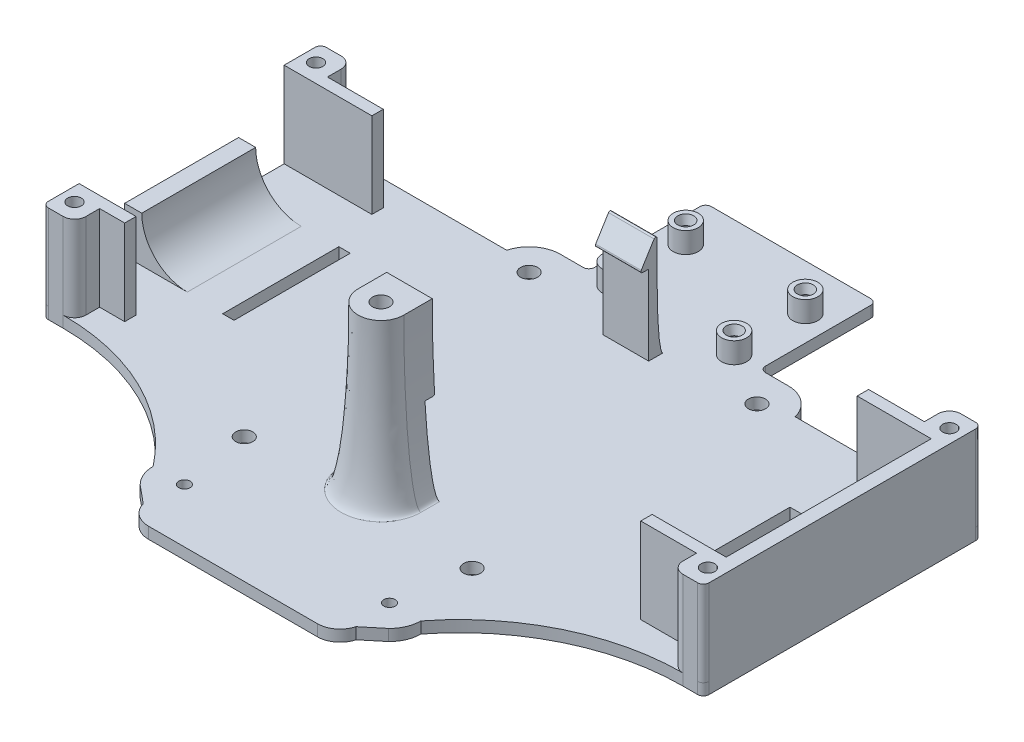
from build123d import *
from OCP.BRepFilletAPI import BRepFilletAPI_MakeChamfer, BRepFilletAPI_MakeFillet

# Parameters (mm, degrees)
SKETCH1_W            = 116
SKETCH1_H            = 98
SKETCH1_R            = 1.5
BOSS_EXTRUDE1_DEPTH  = 2
FILLET1_R            = 5
SKETCH4_R            = 1.2
BOSS_EXTRUDE3_DEPTH  = 15
FILLET2_R1           = 2
FILLET2_R2           = 1
CUT_EXTRUDE1_DEPTH   = 15
SKETCH7_R            = 2.2
BOSS_EXTRUDE4_DEPTH  = 3.65
SKETCH8_R            = 1
CUT_EXTRUDE2_DEPTH   = 153.278765755
CHAMFER2_SIZE        = 0.4
CHAMFER2_SIZE2       = 1.492820323
SKETCH9_R            = 1
CUT_EXTRUDE3_DEPTH   = 3.65
SKETCH10_W           = 3
SKETCH10_H           = 20
BOSS_EXTRUDE5_DEPTH  = 8
CUT_EXTRUDE4_DEPTH   = 4
FILLET4_R            = 1
SKETCH12_W           = 116
SKETCH12_H           = 48.8
CUT_EXTRUDE5_DEPTH   = 15
SKETCH13_R           = 1.2
BOSS_EXTRUDE6_DEPTH  = 15
SKETCH14_R           = 1.2
BOSS_EXTRUDE7_DEPTH  = 15
SKETCH15_W           = 3
SKETCH15_H           = 20
BOSS_EXTRUDE8_DEPTH  = 8
FILLET5_R            = 8
FILLET6_R1           = 2
FILLET6_R2           = 1
SKETCH17_R           = 1.5
BOSS_EXTRUDE9_DEPTH  = 28.5
FILLET8_SIZE         = 3
FILLET8_SIZE_2       = 28.5
SKETCH18_W           = 14
SKETCH18_H           = 1.6
CUT_EXTRUDE6_DEPTH   = 14
MOVE_FACE1_BY        = 0.1
SKETCH19_W           = 8
SKETCH19_H           = 1.5
BOSS_EXTRUDE10_DEPTH = 14
BOSS_EXTRUDE11_DEPTH = 8
FILLET10_R           = 0.3
FILLET11_SIZE        = 1
FILLET11_SIZE_2      = 10.2
SKETCH21_W           = 1.6
SKETCH21_H           = 20
CUT_EXTRUDE7_DEPTH   = 2
MOVE_FACE3_BY        = 0.2
MOVE_FACE3_2_BY      = 0.2
MOVE_FACE3_3_BY      = 0.2
MOVE_FACE3_4_BY      = 0.2
MOVE_FACE3_5_BY      = 0.2
MOVE_FACE3_6_BY      = 0.2
MOVE_FACE3_7_BY      = 0.2
MOVE_FACE3_8_BY      = 0.2


# Some blends are built 0.0001 mm under size
with BuildPart() as part:
    # Sketch1 → Boss-Extrude1 (new body)
    with BuildSketch(Plane(origin=(0, 0, 0), x_dir=(1, 0, 0), z_dir=(0, 1, 0))):
        with Locations((58, 49)):
            Rectangle(SKETCH1_W, SKETCH1_H)
        with Locations(Location((38, 72, 0), (0, 0, 270))):
            Circle(SKETCH1_R, mode=Mode.SUBTRACT)
        with Locations(Location((78, 72, 0), (0, 0, 270))):
            Circle(SKETCH1_R, mode=Mode.SUBTRACT)
        with Locations(Location((78, 22, 0), (0, 0, 270))):
            Circle(SKETCH1_R, mode=Mode.SUBTRACT)
        with Locations(Location((38, 22, 0), (0, 0, 270))):
            Circle(SKETCH1_R, mode=Mode.SUBTRACT)
    extrude(amount=BOSS_EXTRUDE1_DEPTH)

    # Fillet1
    fillet1_edges = [part.edges().sort_by_distance(p)[0] for p in [
        (0, 1, -98),
        (116, 1, -98),
        (116, 1, 0),
        (0, 1, 0),
    ]]
    fillet(fillet1_edges, radius=FILLET1_R)

    # Sketch4 → Boss-Extrude3 (add)
    # profile 1 of 3: a face of its own
    with BuildSketch(Plane(origin=(0, 2, 0), x_dir=(1, 0, 0), z_dir=(0, 1, 0))):
        Polygon((2.4, 67), (2.4, 31), (15.4, 31), (15.4, 29), (5.6, 29), (5.6, 24.6), (0, 24.6), (0, 29), (0, 69), (0, 73.4), (5.6, 73.4), (5.6, 69), (15.4, 69), (15.4, 67), align=None)
        with Locations(Location((2.4, 70.2, 0), (0, 0, 270))):
            Circle(SKETCH4_R, mode=Mode.SUBTRACT)
        with Locations(Location((2.4, 27.8, 0), (0, 0, 270))):
            Circle(SKETCH4_R, mode=Mode.SUBTRACT)
    # profile 2 of 3: a face of its own
    with BuildSketch(Plane(origin=(0, 2, 0), x_dir=(1, 0, 0), z_dir=(0, 1, 0))):
        Polygon((110.4, 69), (100.6, 69), (100.6, 67), (113.6, 67), (116, 67), (116, 69), (116, 73.4), (110.4, 73.4), align=None)
        with Locations(Location((113.6, 70.2, 0), (0, 0, 90))):
            Circle(SKETCH4_R, mode=Mode.SUBTRACT)
    # profile 3 of 3: a face of its own
    with BuildSketch(Plane(origin=(0, 2, 0), x_dir=(1, 0, 0), z_dir=(0, 1, 0))):
        Polygon((110.4, 29), (100.6, 29), (100.6, 31), (113.6, 31), (116, 31), (116, 29), (116, 24.6), (110.4, 24.6), align=None)
        with Locations(Location((113.6, 27.8, 0), (0, 0, 90))):
            Circle(SKETCH4_R, mode=Mode.SUBTRACT)
    extrude(amount=BOSS_EXTRUDE3_DEPTH)

    # Fillet2: one fillet with a radius per group of edges: ONE call of the kernel's fillet builder (fillet() takes one radius for all edges)
    fillet2_edges_1 = [part.edges().sort_by_distance(p)[0] for p in [
        (5.6, 9.5, -24.6),
        (5.6, 9.5, -73.4),
        (110.4, 9.5, -73.4),
        (110.4, 9.5, -24.6),
    ]]
    fillet2_edges_2 = [part.edges().sort_by_distance(p)[0] for p in [
        (0, 9.5, -73.4),
        (0, 9.5, -24.6),
        (116, 9.5, -73.4),
        (116, 9.5, -24.6),
    ]]
    fillet2 = BRepFilletAPI_MakeFillet(part.part.solid().wrapped)
    for e in fillet2_edges_1:
        fillet2.Add(FILLET2_R1, e.wrapped)
    for e in fillet2_edges_2:
        fillet2.Add(FILLET2_R2, e.wrapped)
    add(Compound.cast(fillet2.Shape()), mode=Mode.REPLACE)

    # Sketch6 → Cut-Extrude1 (cut)
    with BuildSketch(Plane(origin=(0, 2, 0), x_dir=(1, 0, 0), z_dir=(0, 1, 0))):
        with BuildLine():
            Line((36.185054688, 5.53815797), (39.317482984, 2.941906208))
            ThreePointArc((39.317482984, 2.941906208), (40.74934289, 0.819404524), (43.175, 0))
            Line((43.175, 0), (72.825, 0))
            ThreePointArc((72.825, 0), (75.25065711, 0.819404524), (76.682517016, 2.941906208))
            Line((76.682517016, 2.941906208), (79.814945312, 5.53815797))
            ThreePointArc((79.814945312, 5.53815797), (81.061234988, 7.347350379), (81.5, 9.5))
            ThreePointArc((81.5, 9.5), (95.203924866, 20.623094148), (112.4, 24.6))
            Line((112.4, 24.6), (115, 24.6))
            ThreePointArc((115, 24.6), (115.707106781, 24.892893219), (116, 25.6))
            Line((116, 25.6), (116, -9.4))
            Line((116, -9.4), (0, -9.4))
            Line((0, -9.4), (0, 25.6))
            ThreePointArc((0, 25.6), (0.292893219, 24.892893219), (1, 24.6))
            Line((1, 24.6), (3.6, 24.6))
            ThreePointArc((3.6, 24.6), (20.796075134, 20.623094148), (34.5, 9.5))
            ThreePointArc((34.5, 9.5), (34.938765012, 7.347350379), (36.185054688, 5.53815797))
        make_face()
    extrude(amount=-CUT_EXTRUDE1_DEPTH, mode=Mode.SUBTRACT)

    # Sketch7 → Boss-Extrude4 (add)
    with BuildSketch(Plane(origin=(0, 2, 0), x_dir=(1, 0, 0), z_dir=(0, 1, 0))):
        with Locations(Location((47.5, 90, 0), (0, 0, 90))):
            Circle(SKETCH7_R)
        with Locations(Location((68.5, 90, 0), (0, 0, 90))):
            Circle(SKETCH7_R)
        with Locations(Location((68.5, 77.5, 0), (0, 0, 90))):
            Circle(SKETCH7_R)
        with Locations(Location((47.5, 77.5, 0), (0, 0, 90))):
            Circle(SKETCH7_R)
    extrude(amount=BOSS_EXTRUDE4_DEPTH)

    # Sketch8 → Cut-Extrude2 (cut, through all)
    with BuildSketch(Plane(origin=(0, 5.65, 0), x_dir=(1, 0, 0), z_dir=(0, 1, 0))):
        with Locations(Location((47.5, 77.5, 0), (0, 0, 270))):
            Circle(SKETCH8_R)
        with Locations(Location((68.5, 77.5, 0), (0, 0, 270))):
            Circle(SKETCH8_R)
        with Locations(Location((68.5, 90, 0), (0, 0, 270))):
            Circle(SKETCH8_R)
        with Locations(Location((47.5, 90, 0), (0, 0, 270))):
            Circle(SKETCH8_R)
    extrude(amount=-CUT_EXTRUDE2_DEPTH, mode=Mode.SUBTRACT)

    # Chamfer2: one chamfer whose edges measure the first distance from different faces: ONE call of the kernel's chamfer builder (chamfer() names one face for all edges)
    chamfer2_edges_1 = [part.edges().sort_by_distance(p)[0] for p in [
        (47.5, 5.65, -91),
    ]]
    chamfer2_side_1 = [part.faces().sort_by_distance(p)[0] for p in [
        (47.5, 5.65, -87.862225397),
    ]]
    chamfer2_edges_2 = [part.edges().sort_by_distance(p)[0] for p in [
        (68.5, 5.65, -91),
    ]]
    chamfer2_side_2 = [part.faces().sort_by_distance(p)[0] for p in [
        (68.5, 5.65, -87.862225397),
    ]]
    chamfer2_edges_3 = [part.edges().sort_by_distance(p)[0] for p in [
        (68.5, 5.65, -78.5),
    ]]
    chamfer2_side_3 = [part.faces().sort_by_distance(p)[0] for p in [
        (68.5, 5.65, -75.362225397),
    ]]
    chamfer2_edges_4 = [part.edges().sort_by_distance(p)[0] for p in [
        (47.5, 5.65, -78.5),
    ]]
    chamfer2_side_4 = [part.faces().sort_by_distance(p)[0] for p in [
        (47.5, 5.65, -75.362225397),
    ]]
    chamfer2 = BRepFilletAPI_MakeChamfer(part.part.solid().wrapped)
    for e in chamfer2_edges_1:
        chamfer2.Add(CHAMFER2_SIZE, CHAMFER2_SIZE2, e.wrapped, chamfer2_side_1[0].wrapped)  # the first distance lies on this face
    for e in chamfer2_edges_2:
        chamfer2.Add(CHAMFER2_SIZE, CHAMFER2_SIZE2, e.wrapped, chamfer2_side_2[0].wrapped)  # the first distance lies on this face
    for e in chamfer2_edges_3:
        chamfer2.Add(CHAMFER2_SIZE, CHAMFER2_SIZE2, e.wrapped, chamfer2_side_3[0].wrapped)  # the first distance lies on this face
    for e in chamfer2_edges_4:
        chamfer2.Add(CHAMFER2_SIZE, CHAMFER2_SIZE2, e.wrapped, chamfer2_side_4[0].wrapped)  # the first distance lies on this face
    add(Compound.cast(chamfer2.Shape()), mode=Mode.REPLACE)

    # Sketch9 → Cut-Extrude3 (cut)
    with BuildSketch(Plane(origin=(0, 2, 0), x_dir=(1, 0, 0), z_dir=(0, 1, 0))):
        with Locations(Location((40, 9.5, 0), (0, 0, 270))):
            Circle(SKETCH9_R)
        with Locations(Location((76, 9.5, 0), (0, 0, 270))):
            Circle(SKETCH9_R)
    extrude(amount=-CUT_EXTRUDE3_DEPTH, mode=Mode.SUBTRACT)

    # Sketch10 → Boss-Extrude5 (add)
    with BuildSketch(Plane(origin=(0, 2, 0), x_dir=(1, 0, 0), z_dir=(0, 1, 0))):
        with Locations((114.5, 49)):
            Rectangle(SKETCH10_W, SKETCH10_H)
    extrude(amount=BOSS_EXTRUDE5_DEPTH)

    # Sketch11 → Cut-Extrude4 (cut)
    with BuildSketch(Plane(origin=(0, 2, 0), x_dir=(1, 0, 0), z_dir=(0, 1, 0))):
        with BuildLine():
            Line((0, 93), (0, 72.4))
            ThreePointArc((0, 72.4), (0.292893219, 73.107106781), (1, 73.4))
            Line((1, 73.4), (3.6, 73.4))
            Line((3.6, 73.4), (32.681165541, 73.4))
            ThreePointArc((32.681165541, 73.4), (34.642173322, 76.356030303), (38, 77.5))
            Line((38, 77.5), (43, 77.5))
            Line((43, 77.5), (43, 98))
            Line((43, 98), (5, 98))
            ThreePointArc((5, 98), (1.464466094, 96.535533906), (0, 93))
        make_face()
        with BuildLine():
            Line((111, 98), (73, 98))
            Line((73, 98), (73, 77.5))
            Line((73, 77.5), (78, 77.5))
            ThreePointArc((78, 77.5), (81.357826678, 76.356030303), (83.318834459, 73.4))
            Line((83.318834459, 73.4), (112.4, 73.4))
            Line((112.4, 73.4), (115, 73.4))
            ThreePointArc((115, 73.4), (115.707106781, 73.107106781), (116, 72.4))
            Line((116, 72.4), (116, 93))
            ThreePointArc((116, 93), (114.535533906, 96.535533906), (111, 98))
        make_face()
    extrude(amount=-CUT_EXTRUDE4_DEPTH, mode=Mode.SUBTRACT)

    # Fillet4
    fillet4_edges = [part.edges().sort_by_distance(p)[0] for p in [
        (43, 1, -98),
        (43, 1, -77.5),
        (73, 1, -77.5),
        (73, 1, -98),
    ]]
    fillet(fillet4_edges, radius=FILLET4_R)

    # Sketch12 → Cut-Extrude5 (cut)
    with BuildSketch(Plane(origin=(0, 17, 0), x_dir=(1, 0, 0), z_dir=(0, 1, 0))):
        with Locations((58, 49)):
            Rectangle(SKETCH12_W, SKETCH12_H)
    extrude(amount=-CUT_EXTRUDE5_DEPTH, mode=Mode.SUBTRACT)

    # Sketch13 → Boss-Extrude6 (add)
    with BuildSketch(Plane(origin=(0, 2, 0), x_dir=(1, 0, 0), z_dir=(0, 1, 0))):
        Polygon((116, 29), (116, 24.6), (110.4, 24.6), (110.4, 29), (100.6, 29), (100.6, 31), (113.6, 31), (113.6, 67), (100.6, 67), (100.6, 69), (110.4, 69), (110.4, 73.4), (116, 73.4), (116, 69), align=None)
        with Locations(Location((113.6, 70.2, 0), (0, 0, 90))):
            Circle(SKETCH13_R, mode=Mode.SUBTRACT)
        with Locations(Location((113.6, 27.8, 0), (0, 0, 90))):
            Circle(SKETCH13_R, mode=Mode.SUBTRACT)
    extrude(amount=BOSS_EXTRUDE6_DEPTH)

    # Sketch14 → Boss-Extrude7 (add)
    # profile 1 of 2: a face of its own
    with BuildSketch(Plane(origin=(0, 2, 0), x_dir=(1, 0, 0), z_dir=(0, 1, 0))):
        Polygon((10, 29), (5.6, 29), (5.6, 24.6), (0, 24.6), (0, 29), (0, 31), (2.4, 31), (10, 31), align=None)
        with Locations(Location((2.4, 27.8, 0), (0, 0, 90))):
            Circle(SKETCH14_R, mode=Mode.SUBTRACT)
    # profile 2 of 2: a face of its own
    with BuildSketch(Plane(origin=(0, 2, 0), x_dir=(1, 0, 0), z_dir=(0, 1, 0))):
        Polygon((15.4, 69), (15.4, 67), (2.4, 67), (0, 67), (0, 69), (0, 73.4), (5.6, 73.4), (5.6, 69), align=None)
        with Locations(Location((2.4, 70.2, 0), (0, 0, 90))):
            Circle(SKETCH14_R, mode=Mode.SUBTRACT)
    extrude(amount=BOSS_EXTRUDE7_DEPTH)

    # Sketch15 → Boss-Extrude8 (add)
    with BuildSketch(Plane(origin=(0, 2, 0), x_dir=(1, 0, 0), z_dir=(0, 1, 0))):
        with Locations((1.5, 49)):
            Rectangle(SKETCH15_W, SKETCH15_H)
    extrude(amount=BOSS_EXTRUDE8_DEPTH)

    # Fillet5
    fillet5_edges = [part.edges().sort_by_distance(p)[0] for p in [
        (3, 2, -49),
    ]]
    fillet(fillet5_edges, radius=FILLET5_R - 0.0001)  # a hair under: the kernel refuses the full size

    # Fillet6: one fillet with a radius per group of edges: ONE call of the kernel's fillet builder (fillet() takes one radius for all edges)
    fillet6_edges_1 = [part.edges().sort_by_distance(p)[0] for p in [
        (5.6, 9.5, -24.6),
        (5.6, 9.5, -73.4),
        (110.4, 9.5, -73.4),
        (110.4, 9.5, -24.6),
    ]]
    fillet6_edges_2 = [part.edges().sort_by_distance(p)[0] for p in [
        (0, 9.5, -73.4),
        (0, 9.5, -24.6),
        (116, 9.5, -24.6),
        (116, 9.5, -73.4),
    ]]
    fillet6 = BRepFilletAPI_MakeFillet(part.part.solid().wrapped)
    for e in fillet6_edges_1:
        fillet6.Add(FILLET6_R1, e.wrapped)
    for e in fillet6_edges_2:
        fillet6.Add(FILLET6_R2, e.wrapped)
    add(Compound.cast(fillet6.Shape()), mode=Mode.REPLACE)

    # Sketch17 → Boss-Extrude9 (add)
    with BuildSketch(Plane(origin=(0, 2, 0), x_dir=(1, 0, 0), z_dir=(0, 1, 0))):
        with BuildLine():
            Line((62, 31), (54, 31))
            Line((54, 31), (54, 26))
            ThreePointArc((54, 26), (58, 22), (62, 26))
            Line((62, 26), (62, 31))
        make_face()
        with Locations(Location((58, 26, 0), (0, 0, 90))):
            Circle(SKETCH17_R, mode=Mode.SUBTRACT)
    extrude(amount=BOSS_EXTRUDE9_DEPTH)

    # Fillet8
    # an asymmetric fillet: 28.5, 3 mm, written as the material it adds along each edge
    with BuildSketch(Plane(origin=(62, 2, -26), x_dir=(1, 0, 0), z_dir=(0, 0, -1)), Plane(origin=(54, 2, -31), x_dir=(-1, 0, 0), z_dir=(0, 0, 1))) as fillet8_piece_1:
        with BuildLine():
            Bezier((FILLET8_SIZE, 0), (0, 0), (0, -FILLET8_SIZE_2), weights=[1, 0.707106781, 1])
            Line((0, -FILLET8_SIZE_2), (0, 0))
            Line((0, 0), (FILLET8_SIZE, 0))
        make_face()
    extrude(amount=5)
    with BuildSketch(Plane(origin=(58, 2, -26), x_dir=(-1, 0, 0), z_dir=(0, 0, -1))) as fillet8_piece_2:
        with BuildLine():
            Bezier((4 + FILLET8_SIZE, 0), (4, 0), (4, FILLET8_SIZE_2), weights=[1, 0.707106781, 1])
            Line((4, FILLET8_SIZE_2), (4, 0))
            Line((4, 0), (4 + FILLET8_SIZE, 0))
        make_face()
    revolve(axis=Axis((58, 2, -26), (0, 1, 0)), revolution_arc=180)

    # Sketch18 → Cut-Extrude6 (cut)
    with BuildSketch(Plane(origin=(0, 16, 0), x_dir=(1, 0, 0), z_dir=(0, 1, 0))):
        with Locations((58, 30.2)):
            Rectangle(SKETCH18_W, SKETCH18_H)
    extrude(amount=-CUT_EXTRUDE6_DEPTH, mode=Mode.SUBTRACT)

    # Move Face1: a face moved inward by 0.1
    extrude(part.faces().sort_by_distance((58, 8.553436183, -29.4))[0], amount=MOVE_FACE1_BY, dir=(0, 0, 1), mode=Mode.SUBTRACT)

    # Sketch19 → Boss-Extrude10 (add)
    with BuildSketch(Plane(origin=(0, 2, 0), x_dir=(1, 0, 0), z_dir=(0, 1, 0))):
        with Locations((58, 69.75)):
            Rectangle(SKETCH19_W, SKETCH19_H)
    extrude(amount=BOSS_EXTRUDE10_DEPTH)

    # Sketch20 → Boss-Extrude11 (add)
    with BuildSketch(Plane.ZY.offset(-54)):
        Polygon((-70.5, 16), (-67.4, 16), (-70.5, 21), align=None)
    extrude(amount=-BOSS_EXTRUDE11_DEPTH)

    # Fillet10
    fillet10_edges = [part.edges().sort_by_distance(p)[0] for p in [
        (58, 16, -31),
        (58, 16, -67.4),
        (58, 21, -70.5),
    ]]
    fillet(fillet10_edges, radius=FILLET10_R)

    # Fillet11
    # an asymmetric fillet: 10.2, 1 mm, written as the material it adds along each edge
    with BuildSketch(Plane(origin=(54, 2, -70.5), x_dir=(0, 0, -1), z_dir=(1, 0, 0))) as fillet11_piece_1:
        with BuildLine():
            Bezier((FILLET11_SIZE, 0), (0, 0), (0, FILLET11_SIZE_2), weights=[1, 0.707106781, 1])
            Line((0, FILLET11_SIZE_2), (0, 0))
            Line((0, 0), (FILLET11_SIZE, 0))
        make_face()
    extrude(amount=8)

    # Sketch21 → Cut-Extrude7 (cut)
    with BuildSketch(Plane(origin=(0, 2, 0), x_dir=(1, 0, 0), z_dir=(0, 1, 0))):
        with Locations((97.6, 49)):
            Rectangle(SKETCH21_W, SKETCH21_H)
        with Locations((18.4, 49)):
            Rectangle(SKETCH21_W, SKETCH21_H)
    extrude(amount=-CUT_EXTRUDE7_DEPTH, mode=Mode.SUBTRACT)

    # Move Face3: a face moved inward by 0.2
    extrude(part.faces().sort_by_distance((18.4, 1, -59))[0], amount=MOVE_FACE3_BY, dir=(0, 0, -1), mode=Mode.SUBTRACT)

    # Move Face3 2: a face moved inward by 0.2
    extrude(part.faces().sort_by_distance((19.2, 1, -49))[0], amount=MOVE_FACE3_2_BY, dir=(1, 0, 0), mode=Mode.SUBTRACT)

    # Move Face3 3: a face moved inward by 0.2
    extrude(part.faces().sort_by_distance((17.6, 1, -49))[0], amount=MOVE_FACE3_3_BY, dir=(-1, 0, 0), mode=Mode.SUBTRACT)

    # Move Face3 4: a face moved inward by 0.2
    extrude(part.faces().sort_by_distance((18.4, 1, -39))[0], amount=MOVE_FACE3_4_BY, dir=(0, 0, 1), mode=Mode.SUBTRACT)

    # Move Face3 5: a face moved inward by 0.2
    extrude(part.faces().sort_by_distance((97.6, 1, -59))[0], amount=MOVE_FACE3_5_BY, dir=(0, 0, -1), mode=Mode.SUBTRACT)

    # Move Face3 6: a face moved inward by 0.2
    extrude(part.faces().sort_by_distance((96.8, 1, -49))[0], amount=MOVE_FACE3_6_BY, dir=(-1, 0, 0), mode=Mode.SUBTRACT)

    # Move Face3 7: a face moved inward by 0.2
    extrude(part.faces().sort_by_distance((98.4, 1, -49))[0], amount=MOVE_FACE3_7_BY, dir=(1, 0, 0), mode=Mode.SUBTRACT)

    # Move Face3 8: a face moved inward by 0.2
    extrude(part.faces().sort_by_distance((97.6, 1, -39))[0], amount=MOVE_FACE3_8_BY, dir=(0, 0, 1), mode=Mode.SUBTRACT)


solid = part.part
